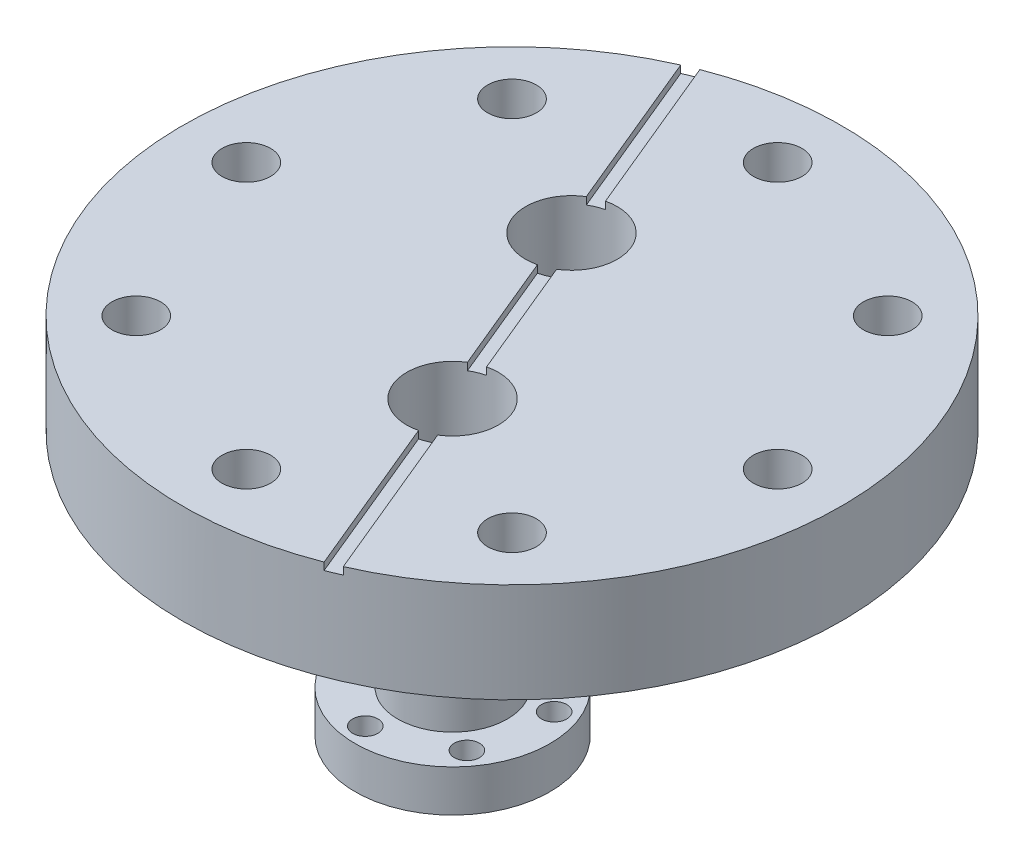
from build123d import *

# Parameters (mm, degrees)
SKETCH1_R         = 57.15
EXTRUDE1_DEPTH    = 17.272
SKETCH3_R         = 4.2164
EXTRUDE2_DEPTH    = 83.647244261
CIRPATTERN1_COUNT = 8
SKETCH5_R         = 9.4996
SKETCH5_R_2       = 7.9375
EXTRUDE3_DEPTH    = 33.3375
EXTRUDE4_START    = -7.239
SKETCH6_R         = 16.891
SKETCH6_R_2       = 7.9375
EXTRUDE4_DEPTH    = 7.239
EXTRUDE5_REACH    = 97.36
SKETCH7_R         = 2.1844
CIRPATTERN2_COUNT = 6
SKETCH8_R         = 7.9375
EXTRUDE6_DEPTH    = 96.360193426
SKETCH9_R         = 16.891
SKETCH9_R_2       = 7.9375
EXTRUDE7_DEPTH    = 7.239
SKETCH11_R        = 7.9375
EXTRUDE8_DEPTH    = 85.931600139
SKETCH12_R        = 2.1844
EXTRUDE9_DEPTH    = 7.239
CIRPATTERN3_COUNT = 6
EXTRUDE10_DEPTH   = 1.27


with BuildPart() as part:
    # Sketch1 → Extrude1 (new body)
    with BuildSketch(Plane(origin=(0, 0, 0), x_dir=(1, 0, 0), z_dir=(0, 1, 0))):
        Circle(SKETCH1_R)
    extrude(amount=EXTRUDE1_DEPTH)

    # Sketch3 → Extrude2 (cut, through all)
    with BuildSketch(Plane.XZ):
        with Locations((0, 46.0756)):
            Circle(SKETCH3_R)
    extrude2 = extrude(amount=-EXTRUDE2_DEPTH, mode=Mode.SUBTRACT)

    # CirPattern1: Extrude2 ×8 about axis
    cirpattern1_axis = Axis((0, 17.272, 0), (0, -1, 0))
    for i in range(1, CIRPATTERN1_COUNT):
        add(extrude2.rotate(cirpattern1_axis, i * 360 / CIRPATTERN1_COUNT), mode=Mode.SUBTRACT)

    # Sketch5 → Extrude3 (add)
    with BuildSketch(Plane.XZ):
        with Locations((7.290119387, 17.599905094)):
            Circle(SKETCH5_R)
        with Locations((7.290119387, 17.599905094)):
            Circle(SKETCH5_R_2, mode=Mode.SUBTRACT)
    extrude(amount=EXTRUDE3_DEPTH)

    # Sketch6 → Extrude4 (add)
    with BuildSketch(Plane.XZ.offset(33.3375).offset(EXTRUDE4_START)):
        with Locations((7.290119387, 17.599905094)):
            Circle(SKETCH6_R)
        with Locations((7.290119387, 17.599905094)):
            Circle(SKETCH6_R_2, mode=Mode.SUBTRACT)
    extrude(amount=EXTRUDE4_DEPTH)

    # Sketch7 → Extrude5 (cut, up to next)
    with BuildSketch(Plane.XZ.offset(33.3375), mode=Mode.PRIVATE) as extrude5_sk1:
        with Locations((-3.410154455, 9.389296197)):
            Circle(SKETCH7_R)
    extrude5_tool1 = extrude(extrude5_sk1.sketch, amount=-EXTRUDE5_REACH, mode=Mode.PRIVATE) & part.part
    extrude5 = extrude5_tool1.solids().sort_by_distance((-3.410154, -33.3375, 9.389296))[0]
    add(extrude5, mode=Mode.SUBTRACT)

    # CirPattern2: Extrude5 ×6 about axis
    cirpattern2_axis = Axis((7.290119387, -33.3375, 17.599905094), (0, 1, 0))
    for i in range(1, CIRPATTERN2_COUNT):
        add(extrude5.rotate(cirpattern2_axis, i * 360 / CIRPATTERN2_COUNT), mode=Mode.SUBTRACT)

    # Sketch8 → Extrude6 (cut, through all)
    with BuildSketch(Plane.XZ.offset(33.3375)):
        with Locations((7.290119387, 17.599905094)):
            Circle(SKETCH8_R)
    extrude(amount=-EXTRUDE6_DEPTH, mode=Mode.SUBTRACT)

    # Sketch9 → Extrude7 (add)
    with BuildSketch(Plane.XZ):
        with Locations((-7.290119387, -17.599905094)):
            Circle(SKETCH9_R)
        with Locations((-7.290119387, -17.599905094)):
            Circle(SKETCH9_R_2, mode=Mode.SUBTRACT)
    extrude(amount=EXTRUDE7_DEPTH)

    # Sketch11 → Extrude8 (cut, through all)
    with BuildSketch(Plane.XZ.offset(7.239)):
        with Locations((-7.290119387, -17.599905094)):
            Circle(SKETCH11_R)
    extrude(amount=-EXTRUDE8_DEPTH, mode=Mode.SUBTRACT)

    # Sketch12 → Extrude9 (cut)
    with BuildSketch(Plane.XZ.offset(7.239)):
        with Locations((3.410154455, -9.389296197)):
            Circle(SKETCH12_R)
    extrude9 = extrude(amount=-EXTRUDE9_DEPTH, mode=Mode.SUBTRACT)

    # CirPattern3: Extrude9 ×6 about axis
    cirpattern3_axis = Axis((-7.290119387, -7.239, -17.599905094), (0, 1, 0))
    for i in range(1, CIRPATTERN3_COUNT):
        add(extrude9.rotate(cirpattern3_axis, i * 360 / CIRPATTERN3_COUNT), mode=Mode.SUBTRACT)

    # Sketch13 → Extrude10 (cut)
    with BuildSketch(Plane(origin=(0, 17.272, 0), x_dir=(1, 0, 0), z_dir=(0, 1, 0))):
        Polygon((-24.155973891, 61.636349712), (-26.502627904, 60.664333794), (25.660622812, -65.268893542), (28.007276825, -64.296877624), align=None)
    extrude(amount=-EXTRUDE10_DEPTH, mode=Mode.SUBTRACT)


solid = part.part
